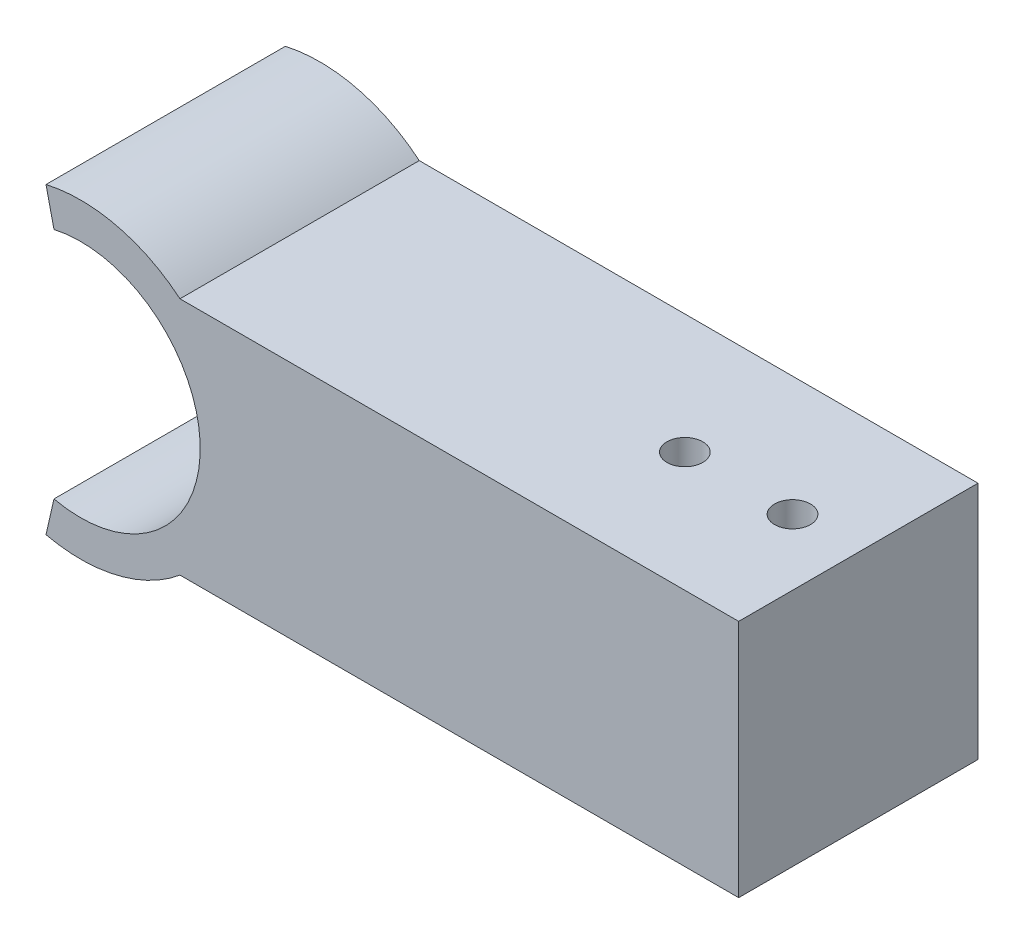
from build123d import *

# Parameters (mm, degrees)
EXTRUDE_1_DEPTH     = 20
SKETCH_2_R          = 1.5
CUT_EXTRUDE_1_DEPTH = 63.880839689


with BuildPart() as part:
    # Эскиз1 → Бобышка-Вытянуть1 (new body)
    with BuildSketch(Plane.XY):
        with BuildLine():
            Line((-2.222048604, 9.75), (-2.888663186, 12.675))
            ThreePointArc((-2.888663186, 12.675), (3.021172078, 12.644070518), (8.306623863, 10))
            Line((8.306623863, 10), (55, 10))
            Line((55, 10), (55, 0))
            Line((55, 0), (55, -10))
            Line((55, -10), (8.306623863, -10))
            ThreePointArc((8.306623863, -10), (3.021172078, -12.644070518), (-2.888663186, -12.675))
            Line((-2.888663186, -12.675), (-2.222048604, -9.75))
            ThreePointArc((-2.222048604, -9.75), (10, 0), (-2.222048604, 9.75))
        make_face()
    extrude(amount=EXTRUDE_1_DEPTH)

    # Эскиз2 → Вырез-Вытянуть1 (cut, through all)
    with BuildSketch(Plane(origin=(0, 10, 0), x_dir=(1, 0, 0), z_dir=(0, 1, 0))):
        with Locations((40.5, -10)):
            Circle(SKETCH_2_R)
        with Locations((49.5, -10)):
            Circle(SKETCH_2_R)
    extrude(amount=-CUT_EXTRUDE_1_DEPTH, mode=Mode.SUBTRACT)


solid = part.part
